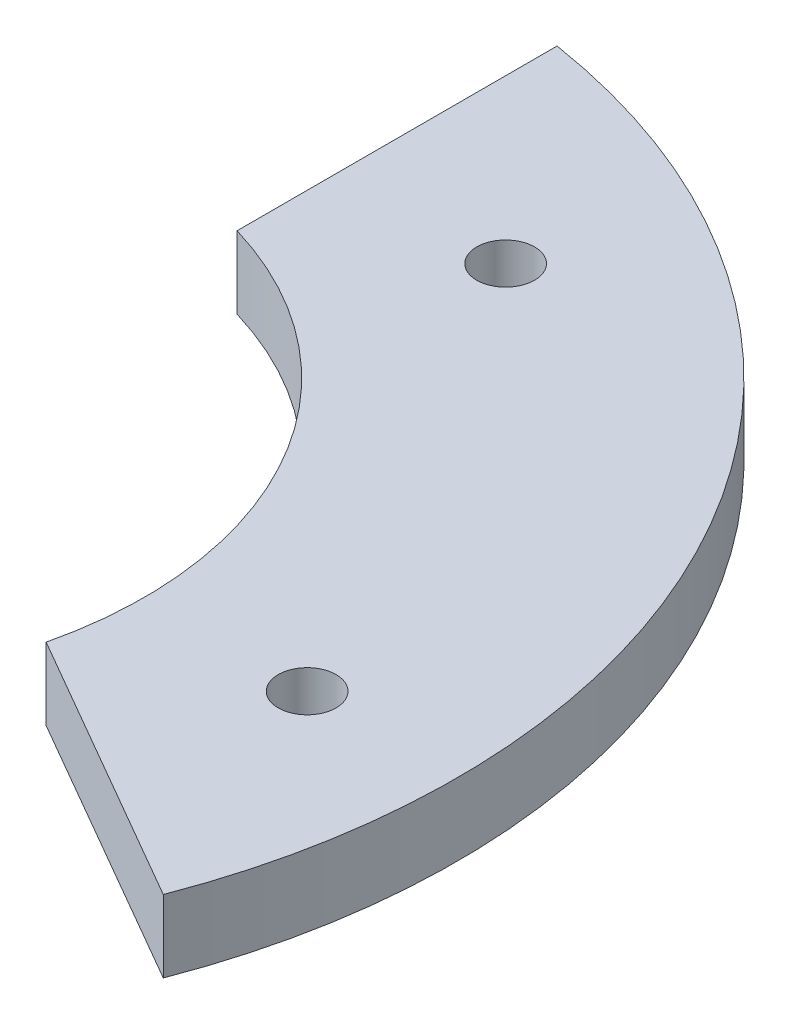
from build123d import *

# Parameters (mm, degrees)
SKETCH1_R           = 38.3
SKETCH1_R_2         = 1.6
SKETCH1_R_3         = 21
BOSS_EXTRUDE1_DEPTH = 4
CUT_EXTRUDE1_DEPTH  = 10


with BuildPart() as part:
    # Sketch1 → Boss-Extrude1 (new body)
    with BuildSketch(Plane(origin=(0, 0, 0), x_dir=(1, 0, 0), z_dir=(0, 1, 0))):
        Circle(SKETCH1_R)
        with Locations((30, 0)):
            Circle(SKETCH1_R_2, mode=Mode.SUBTRACT)
        Circle(SKETCH1_R_3, mode=Mode.SUBTRACT)
        with Locations((15, -25.980762114)):
            Circle(SKETCH1_R_2, mode=Mode.SUBTRACT)
        with Locations((-15, -25.980762114)):
            Circle(SKETCH1_R_2, mode=Mode.SUBTRACT)
        with Locations((-30, 0)):
            Circle(SKETCH1_R_2, mode=Mode.SUBTRACT)
        with Locations((-15, 25.980762114)):
            Circle(SKETCH1_R_2, mode=Mode.SUBTRACT)
        with Locations((15, 25.980762114)):
            Circle(SKETCH1_R_2, mode=Mode.SUBTRACT)
    extrude(amount=BOSS_EXTRUDE1_DEPTH)

    # Sketch2 → Cut-Extrude1 (cut)
    with BuildSketch(Plane(origin=(0, 4, 0), x_dir=(1, 0, 0), z_dir=(0, 1, 0))):
        with BuildLine():
            Line((6, 50.276302336), (6, 14.297506921))
            ThreePointArc((6, 14.297506921), (13.428105902, 7.752720557), (15.382004204, -1.952601038))
            Line((15.382004204, -1.952601038), (46.540555031, -19.941998745))
            ThreePointArc((46.540555031, -19.941998745), (-43.84951462, -25.31652907), (6, 50.276302336))
        make_face()
    extrude(amount=-CUT_EXTRUDE1_DEPTH, mode=Mode.SUBTRACT)


solid = part.part
